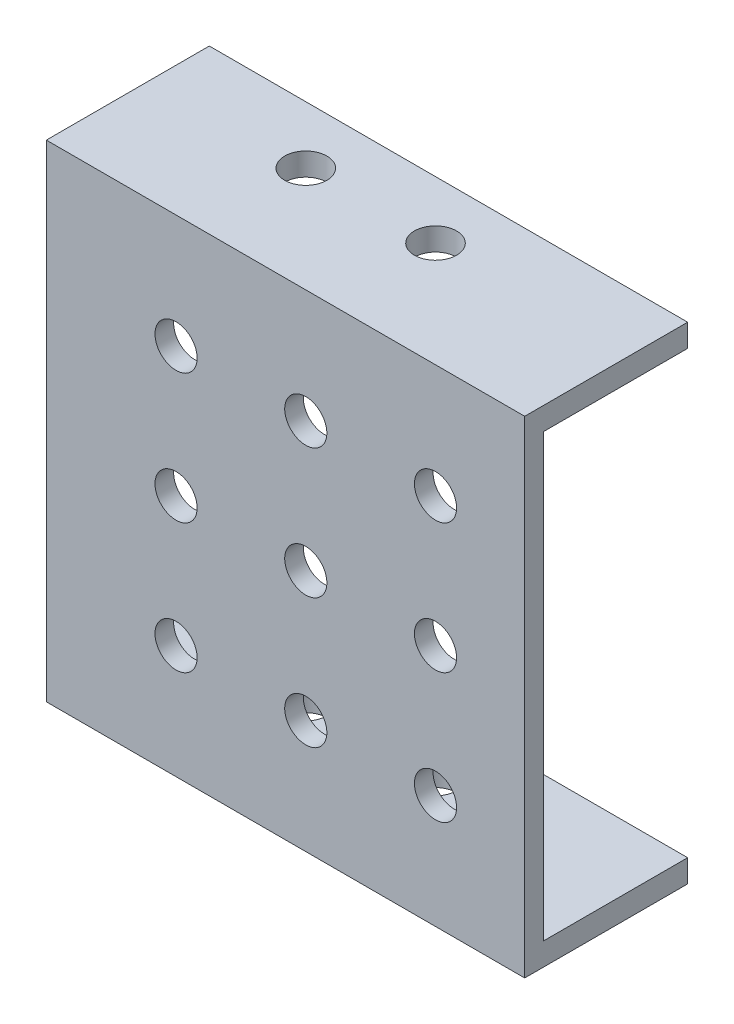
from build123d import *

# Parameters (mm, degrees)
SKETCH_1_W          = 295
SKETCH_1_H          = 300
SKETCH_1_R          = 13
EXTRUDE_469_DEPTH   = 11.5
SKETCH_2_W          = 295
SKETCH_2_H          = 14
EXTRUDE_1_DEPTH     = 89
SKETCH_3_R          = 13
CUT_EXTRUDE_1_DEPTH = 346.943998358


with BuildPart() as part:
    # 草图1 → Extrude 469 (new body)
    with BuildSketch(Plane.XY):
        with Locations((0, 150)):
            Rectangle(SKETCH_1_W, SKETCH_1_H)
        with Locations((92.5, 230)):
            Circle(SKETCH_1_R, mode=Mode.SUBTRACT)
        with Locations((92.5, 150)):
            Circle(SKETCH_1_R, mode=Mode.SUBTRACT)
        with Locations((92.5, 70)):
            Circle(SKETCH_1_R, mode=Mode.SUBTRACT)
        with Locations((12.5, 230)):
            Circle(SKETCH_1_R, mode=Mode.SUBTRACT)
        with Locations((-67.5, 230)):
            Circle(SKETCH_1_R, mode=Mode.SUBTRACT)
        with Locations((-67.5, 150)):
            Circle(SKETCH_1_R, mode=Mode.SUBTRACT)
        with Locations((-67.5, 70)):
            Circle(SKETCH_1_R, mode=Mode.SUBTRACT)
        with Locations((12.5, 70)):
            Circle(SKETCH_1_R, mode=Mode.SUBTRACT)
        with Locations((12.5, 150)):
            Circle(SKETCH_1_R, mode=Mode.SUBTRACT)
    extrude(amount=EXTRUDE_469_DEPTH)

    # 草图2 → 凸台-拉伸1 (add)
    with BuildSketch(Plane(origin=(0, 0, 0), x_dir=(-1, 0, 0), z_dir=(0, 0, -1))):
        with Locations((0, 293)):
            Rectangle(SKETCH_2_W, SKETCH_2_H)
        with Locations((0, 7)):
            Rectangle(SKETCH_2_W, SKETCH_2_H)
    extrude(amount=EXTRUDE_1_DEPTH)

    # 草图3 → 切除-拉伸1 (cut, through all)
    with BuildSketch(Plane(origin=(0, 300, 0), x_dir=(-1, 0, 0), z_dir=(0, 1, 0))):
        with Locations((-27.5, -53.5)):
            Circle(SKETCH_3_R)
        with Locations((52.5, -53.5)):
            Circle(SKETCH_3_R)
    extrude(amount=-CUT_EXTRUDE_1_DEPTH, mode=Mode.SUBTRACT)


solid = part.part
